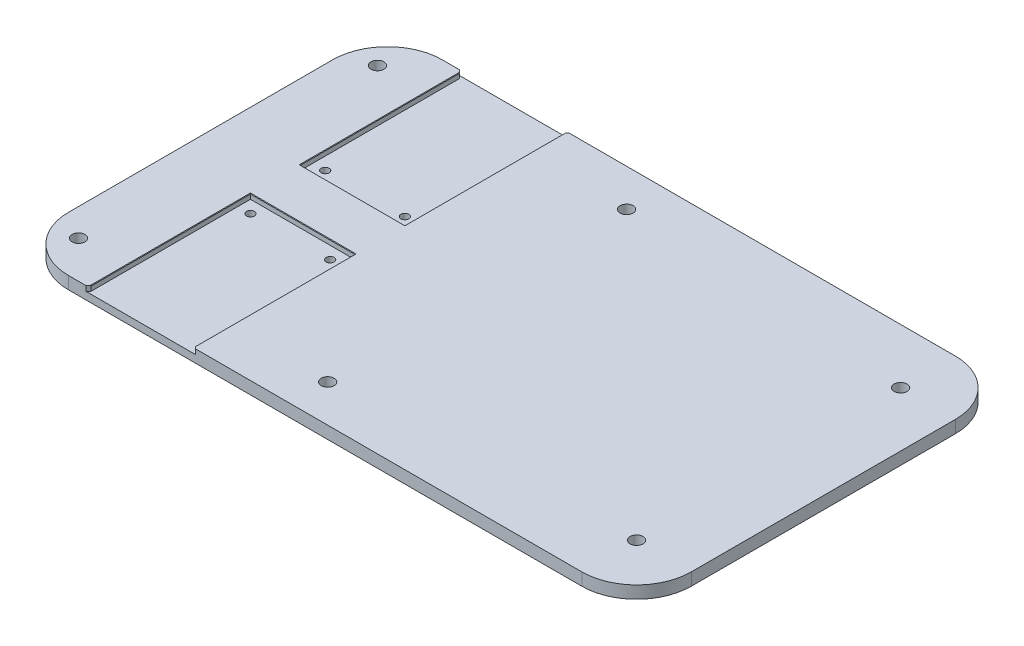
from build123d import *

# Parameters (mm, degrees)
SKETCH_1_R          = 2.6
EXTRUDE_1_DEPTH     = 5
SKETCH_2_W          = 42
SKETCH_2_H          = 65
CUT_EXTRUDE_1_DEPTH = 2
CHAMFER_1_SIZE      = 0.2
CHAMFER_2_SIZE      = 1
SKETCH_3_R          = 1.6
CUT_EXTRUDE_2_DEPTH = 3


with BuildPart() as part:
    # 草图1 → 凸台-拉伸1 (new body)
    with BuildSketch(Plane(origin=(0, 0, 0), x_dir=(1, 0, 0), z_dir=(0, 1, 0))):
        with BuildLine():
            Line((103, 75), (-103, 75))
            ThreePointArc((-103, 75), (-118.556349186, 68.556349186), (-125, 53))
            Line((-125, 53), (-125, -53))
            ThreePointArc((-125, -53), (-118.556349186, -68.556349186), (-103, -75))
            Line((-103, -75), (103, -75))
            ThreePointArc((103, -75), (118.556349186, -68.556349186), (125, -53))
            Line((125, -53), (125, 53))
            ThreePointArc((125, 53), (118.556349186, 68.556349186), (103, 75))
        make_face()
        with Locations((-114, 60)):
            Circle(SKETCH_1_R, mode=Mode.SUBTRACT)
        with Locations((-14, 60)):
            Circle(SKETCH_1_R, mode=Mode.SUBTRACT)
        with Locations((103, 53)):
            Circle(SKETCH_1_R, mode=Mode.SUBTRACT)
        with Locations((-114, -60)):
            Circle(SKETCH_1_R, mode=Mode.SUBTRACT)
        with Locations((-14, -60)):
            Circle(SKETCH_1_R, mode=Mode.SUBTRACT)
        with Locations((103, -53)):
            Circle(SKETCH_1_R, mode=Mode.SUBTRACT)
    extrude(amount=EXTRUDE_1_DEPTH)

    # 草图2 → 切除-拉伸1 (cut)
    with BuildSketch(Plane(origin=(0, 5, 0), x_dir=(1, 0, 0), z_dir=(0, 1, 0))):
        with Locations((-74, -42.5)):
            Rectangle(SKETCH_2_W, SKETCH_2_H)
        with Locations((-74, 42.5)):
            Rectangle(SKETCH_2_W, SKETCH_2_H)
    extrude(amount=-CUT_EXTRUDE_1_DEPTH, mode=Mode.SUBTRACT)

    # 倒角1
    chamfer_1_edges = [part.edges().sort_by_distance(p)[0] for p in [
        (-53, 5, -42.5),
        (-74, 5, -10),
        (-95, 5, -42.5),
        (-53, 5, 42.5),
        (-74, 5, 10),
        (-95, 5, 42.5),
    ]]
    chamfer(chamfer_1_edges, length=CHAMFER_1_SIZE)

    # 倒角2
    chamfer_2_edges = [part.edges().sort_by_distance(p)[0] for p in [
        (-53, 3.9, 75),
        (-95, 3.9, 75),
        (-95, 3.9, -75),
        (-53, 3.9, -75),
    ]]
    chamfer(chamfer_2_edges, length=CHAMFER_2_SIZE)

    # 草图3 → 切除-拉伸2 (cut)
    with BuildSketch(Plane(origin=(0, 3, 0), x_dir=(1, 0, 0), z_dir=(0, 1, 0))):
        with Locations((-90, 15)):
            Circle(SKETCH_3_R)
        with Locations((-58, 15)):
            Circle(SKETCH_3_R)
        with Locations((-58, -15)):
            Circle(SKETCH_3_R)
        with Locations((-90, -15)):
            Circle(SKETCH_3_R)
    extrude(amount=-CUT_EXTRUDE_2_DEPTH, mode=Mode.SUBTRACT)


solid = part.part
